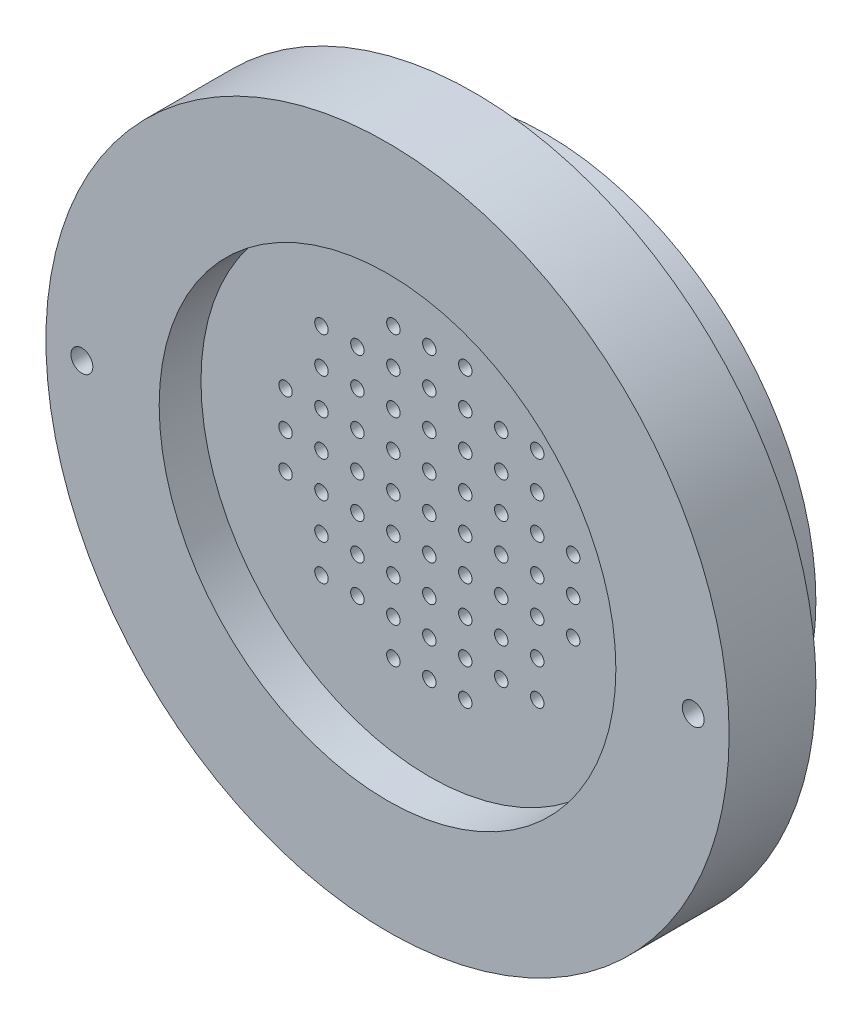
from build123d import *

# Parameters (mm, degrees)
SKETCH1_R                                           = 38
BOSS_EXTRUDE1_DEPTH                                 = 5
SKETCH2_R                                           = 0.75
CUT_EXTRUDE1_DEPTH                                  = 54.972215074
LPATTERN1_COUNT                                     = 5
LPATTERN1_PITCH                                     = 4
LPATTERN1_COUNT_DIR2                                = 5
LPATTERN1_PITCH_DIR2                                = 4
MIRROR1_COPY_1_SKETCH_R                             = 0.75
MIRROR1_COPY_1_DEPTH                                = 54.972215074
MIRROR1_COPY_2_SKETCH_R                             = 0.75
MIRROR1_COPY_2_DEPTH                                = 54.972215074
MIRROR1_COPY_3_SKETCH_R                             = 0.75
MIRROR1_COPY_3_DEPTH                                = 54.972215074
MIRROR1_COPY_4_SKETCH_R                             = 0.75
MIRROR1_COPY_4_DEPTH                                = 54.972215074
MIRROR1_COPY_5_SKETCH_R                             = 0.75
MIRROR1_COPY_5_DEPTH                                = 54.972215074
MIRROR1_COPY_6_SKETCH_R                             = 0.75
MIRROR1_COPY_6_DEPTH                                = 54.972215074
MIRROR1_COPY_7_SKETCH_R                             = 0.75
MIRROR1_COPY_7_DEPTH                                = 54.972215074
MIRROR1_COPY_8_SKETCH_R                             = 0.75
MIRROR1_COPY_8_DEPTH                                = 54.972215074
MIRROR1_COPY_9_SKETCH_R                             = 0.75
MIRROR1_COPY_9_DEPTH                                = 54.972215074
MIRROR1_COPY_10_SKETCH_R                            = 0.75
MIRROR1_COPY_10_DEPTH                               = 54.972215074
MIRROR1_COPY_11_SKETCH_R                            = 0.75
MIRROR1_COPY_11_DEPTH                               = 54.972215074
MIRROR1_COPY_12_SKETCH_R                            = 0.75
MIRROR1_COPY_12_DEPTH                               = 54.972215074
MIRROR1_COPY_13_SKETCH_R                            = 0.75
MIRROR1_COPY_13_DEPTH                               = 54.972215074
MIRROR1_COPY_14_SKETCH_R                            = 0.75
MIRROR1_COPY_14_DEPTH                               = 54.972215074
MIRROR1_COPY_15_SKETCH_R                            = 0.75
MIRROR1_COPY_15_DEPTH                               = 54.972215074
MIRROR1_COPY_16_SKETCH_R                            = 0.75
MIRROR1_COPY_16_DEPTH                               = 54.972215074
MIRROR1_COPY_17_SKETCH_R                            = 0.75
MIRROR1_COPY_17_DEPTH                               = 54.972215074
MIRROR1_COPY_18_SKETCH_R                            = 0.75
MIRROR1_COPY_18_DEPTH                               = 54.972215074
MIRROR1_COPY_19_SKETCH_R                            = 0.75
MIRROR1_COPY_19_DEPTH                               = 54.972215074
MIRROR1_COPY_20_SKETCH_R                            = 0.75
MIRROR1_COPY_20_DEPTH                               = 54.972215074
MIRROR1_AT_THE_SECOND_PLANE_COPY_1_SKETC_R          = 0.75
MIRROR1_AT_THE_SECOND_PLANE_COPY_1_DEPTH            = 54.972215074
MIRROR1_AT_THE_SECOND_PLANE_COPY_2_SKETC_R          = 0.75
MIRROR1_AT_THE_SECOND_PLANE_COPY_2_DEPTH            = 54.972215074
MIRROR1_AT_THE_SECOND_PLANE_COPY_3_SKETC_R          = 0.75
MIRROR1_AT_THE_SECOND_PLANE_COPY_3_DEPTH            = 54.972215074
MIRROR1_AT_THE_SECOND_PLANE_COPY_4_SKETC_R          = 0.75
MIRROR1_AT_THE_SECOND_PLANE_COPY_4_DEPTH            = 54.972215074
MIRROR1_AT_THE_SECOND_PLANE_COPY_5_SKETC_R          = 0.75
MIRROR1_AT_THE_SECOND_PLANE_COPY_5_DEPTH            = 54.972215074
MIRROR1_AT_THE_SECOND_PLANE_COPY_6_SKETC_R          = 0.75
MIRROR1_AT_THE_SECOND_PLANE_COPY_6_DEPTH            = 54.972215074
MIRROR1_AT_THE_SECOND_PLANE_COPY_7_SKETC_R          = 0.75
MIRROR1_AT_THE_SECOND_PLANE_COPY_7_DEPTH            = 54.972215074
MIRROR1_AT_THE_SECOND_PLANE_COPY_8_SKETC_R          = 0.75
MIRROR1_AT_THE_SECOND_PLANE_COPY_8_DEPTH            = 54.972215074
MIRROR1_AT_THE_SECOND_PLANE_COPY_9_SKETC_R          = 0.75
MIRROR1_AT_THE_SECOND_PLANE_COPY_9_DEPTH            = 54.972215074
MIRROR1_AT_THE_SECOND_PLANE_COPY_10_SKET_R          = 0.75
MIRROR1_AT_THE_SECOND_PLANE_COPY_10_DEPTH           = 54.972215074
MIRROR1_AT_THE_SECOND_PLANE_COPY_11_SKET_R          = 0.75
MIRROR1_AT_THE_SECOND_PLANE_COPY_11_DEPTH           = 54.972215074
MIRROR1_AT_THE_SECOND_PLANE_COPY_12_SKET_R          = 0.75
MIRROR1_AT_THE_SECOND_PLANE_COPY_12_DEPTH           = 54.972215074
MIRROR1_AT_THE_SECOND_PLANE_COPY_13_SKET_R          = 0.75
MIRROR1_AT_THE_SECOND_PLANE_COPY_13_DEPTH           = 54.972215074
MIRROR1_AT_THE_SECOND_PLANE_COPY_14_SKET_R          = 0.75
MIRROR1_AT_THE_SECOND_PLANE_COPY_14_DEPTH           = 54.972215074
MIRROR1_AT_THE_SECOND_PLANE_COPY_15_SKET_R          = 0.75
MIRROR1_AT_THE_SECOND_PLANE_COPY_15_DEPTH           = 54.972215074
MIRROR1_AT_THE_SECOND_PLANE_COPY_16_SKET_R          = 0.75
MIRROR1_AT_THE_SECOND_PLANE_COPY_16_DEPTH           = 54.972215074
MIRROR1_AT_THE_SECOND_PLANE_COPY_17_SKET_R          = 0.75
MIRROR1_AT_THE_SECOND_PLANE_COPY_17_DEPTH           = 54.972215074
MIRROR1_AT_THE_SECOND_PLANE_COPY_18_SKET_R          = 0.75
MIRROR1_AT_THE_SECOND_PLANE_COPY_18_DEPTH           = 54.972215074
MIRROR1_AT_THE_SECOND_PLANE_COPY_19_SKET_R          = 0.75
MIRROR1_AT_THE_SECOND_PLANE_COPY_19_DEPTH           = 54.972215074
MIRROR1_AT_THE_SECOND_PLANE_COPY_20_SKET_R          = 0.75
MIRROR1_AT_THE_SECOND_PLANE_COPY_20_DEPTH           = 54.972215074
MIRROR1_AT_THE_SECOND_PLANE_COPY_21_SKET_R          = 0.75
MIRROR1_AT_THE_SECOND_PLANE_COPY_21_DEPTH           = 54.972215074
MIRROR1_AT_THE_SECOND_PLANE_COPY_22_SKET_R          = 0.75
MIRROR1_AT_THE_SECOND_PLANE_COPY_22_DEPTH           = 54.972215074
MIRROR1_AT_THE_SECOND_PLANE_COPY_23_SKET_R          = 0.75
MIRROR1_AT_THE_SECOND_PLANE_COPY_23_DEPTH           = 54.972215074
MIRROR1_AT_THE_SECOND_PLANE_COPY_24_SKET_R          = 0.75
MIRROR1_AT_THE_SECOND_PLANE_COPY_24_DEPTH           = 54.972215074
MIRROR1_AT_THE_SECOND_PLANE_COPY_25_SKET_R          = 0.75
MIRROR1_AT_THE_SECOND_PLANE_COPY_25_DEPTH           = 54.972215074
MIRROR1_AT_THE_SECOND_PLANE_COPY_26_SKET_R          = 0.75
MIRROR1_AT_THE_SECOND_PLANE_COPY_26_DEPTH           = 54.972215074
MIRROR1_AT_THE_SECOND_PLANE_COPY_27_SKET_R          = 0.75
MIRROR1_AT_THE_SECOND_PLANE_COPY_27_DEPTH           = 54.972215074
MIRROR1_AT_THE_SECOND_PLANE_COPY_28_SKET_R          = 0.75
MIRROR1_AT_THE_SECOND_PLANE_COPY_28_DEPTH           = 54.972215074
MIRROR1_AT_THE_SECOND_PLANE_COPY_29_SKET_R          = 0.75
MIRROR1_AT_THE_SECOND_PLANE_COPY_29_DEPTH           = 54.972215074
MIRROR1_AT_THE_SECOND_PLANE_COPY_30_SKET_R          = 0.75
MIRROR1_AT_THE_SECOND_PLANE_COPY_30_DEPTH           = 54.972215074
MIRROR1_AT_THE_SECOND_PLANE_COPY_31_SKET_R          = 0.75
MIRROR1_AT_THE_SECOND_PLANE_COPY_31_DEPTH           = 54.972215074
MIRROR1_AT_THE_SECOND_PLANE_COPY_32_SKET_R          = 0.75
MIRROR1_AT_THE_SECOND_PLANE_COPY_32_DEPTH           = 54.972215074
MIRROR1_AT_THE_SECOND_PLANE_COPY_33_SKET_R          = 0.75
MIRROR1_AT_THE_SECOND_PLANE_COPY_33_DEPTH           = 54.972215074
MIRROR1_AT_THE_SECOND_PLANE_COPY_34_SKET_R          = 0.75
MIRROR1_AT_THE_SECOND_PLANE_COPY_34_DEPTH           = 54.972215074
MIRROR1_AT_THE_SECOND_PLANE_COPY_35_SKET_R          = 0.75
MIRROR1_AT_THE_SECOND_PLANE_COPY_35_DEPTH           = 54.972215074
MIRROR1_AT_THE_SECOND_PLANE_COPY_36_SKET_R          = 0.75
MIRROR1_AT_THE_SECOND_PLANE_COPY_36_DEPTH           = 54.972215074
MIRROR1_AT_THE_SECOND_PLANE_COPY_37_SKET_R          = 0.75
MIRROR1_AT_THE_SECOND_PLANE_COPY_37_DEPTH           = 54.972215074
MIRROR1_AT_THE_SECOND_PLANE_COPY_38_SKET_R          = 0.75
MIRROR1_AT_THE_SECOND_PLANE_COPY_38_DEPTH           = 54.972215074
MIRROR1_AT_THE_SECOND_PLANE_COPY_39_SKET_R          = 0.75
MIRROR1_AT_THE_SECOND_PLANE_COPY_39_DEPTH           = 54.972215074
MIRROR1_AT_THE_SECOND_PLANE_COPY_40_SKET_R          = 0.75
MIRROR1_AT_THE_SECOND_PLANE_COPY_40_DEPTH           = 54.972215074
MIRROR1_AT_THE_SECOND_PLANE_COPY_41_SKET_R          = 0.75
MIRROR1_AT_THE_SECOND_PLANE_COPY_41_DEPTH           = 54.972215074
SKETCH16_R                                          = 38
SKETCH16_R_2                                        = 25.4
BOSS_EXTRUDE2_DEPTH                                 = 4.65
BOSS_EXTRUDE3_START                                 = 8
SKETCH17_R                                          = 30
SKETCH17_R_2                                        = 25.4
BOSS_EXTRUDE3_DEPTH                                 = 8
CBORE_FOR_2_BINDING_HEAD_MACHINE_SCREW1_D           = 2.4384
CBORE_FOR_2_BINDING_HEAD_MACHINE_SCREW1_CBORE_D     = 5.55752
CBORE_FOR_2_BINDING_HEAD_MACHINE_SCREW1_CBORE_DEPTH = 1.27


with BuildPart() as part:
    # Sketch1 → Boss-Extrude1 (new body)
    with BuildSketch(Plane.XY):
        Circle(SKETCH1_R)
    extrude(amount=BOSS_EXTRUDE1_DEPTH)

    # Sketch2 → Cut-Extrude1 (cut, through all)
    with BuildSketch(Plane.XY.offset(5)):
        Circle(SKETCH2_R)
    cut_extrude1 = extrude(amount=-CUT_EXTRUDE1_DEPTH, mode=Mode.SUBTRACT)

    # LPattern1: Cut-Extrude1 5 × 5, 5 skipped
    with Locations(*[(j * LPATTERN1_PITCH_DIR2, i * LPATTERN1_PITCH, 0) for i in range(LPATTERN1_COUNT) for j in range(LPATTERN1_COUNT_DIR2) if (i, j) not in ((0, 0), (2, 4), (3, 4), (4, 2), (4, 3), (4, 4))]):
        add(cut_extrude1, mode=Mode.SUBTRACT)

    # Mirror1 copy 1 sketch → Mirror1 copy 1 (cut, through all)
    with BuildSketch(Plane(origin=(-4, 0, 5), x_dir=(-1, 0, 0), z_dir=(0, 0, 1))):
        Circle(MIRROR1_COPY_1_SKETCH_R)
    extrude(amount=-MIRROR1_COPY_1_DEPTH, mode=Mode.SUBTRACT)

    # Mirror1 copy 2 sketch → Mirror1 copy 2 (cut, through all)
    with BuildSketch(Plane(origin=(-8, 0, 5), x_dir=(-1, 0, 0), z_dir=(0, 0, 1))):
        Circle(MIRROR1_COPY_2_SKETCH_R)
    extrude(amount=-MIRROR1_COPY_2_DEPTH, mode=Mode.SUBTRACT)

    # Mirror1 copy 3 sketch → Mirror1 copy 3 (cut, through all)
    with BuildSketch(Plane(origin=(-12, 0, 5), x_dir=(-1, 0, 0), z_dir=(0, 0, 1))):
        Circle(MIRROR1_COPY_3_SKETCH_R)
    extrude(amount=-MIRROR1_COPY_3_DEPTH, mode=Mode.SUBTRACT)

    # Mirror1 copy 4 sketch → Mirror1 copy 4 (cut, through all)
    with BuildSketch(Plane(origin=(-16, 0, 5), x_dir=(-1, 0, 0), z_dir=(0, 0, 1))):
        Circle(MIRROR1_COPY_4_SKETCH_R)
    extrude(amount=-MIRROR1_COPY_4_DEPTH, mode=Mode.SUBTRACT)

    # Mirror1 copy 5 sketch → Mirror1 copy 5 (cut, through all)
    with BuildSketch(Plane(origin=(0, 4, 5), x_dir=(-1, 0, 0), z_dir=(0, 0, 1))):
        Circle(MIRROR1_COPY_5_SKETCH_R)
    extrude(amount=-MIRROR1_COPY_5_DEPTH, mode=Mode.SUBTRACT)

    # Mirror1 copy 6 sketch → Mirror1 copy 6 (cut, through all)
    with BuildSketch(Plane(origin=(-4, 4, 5), x_dir=(-1, 0, 0), z_dir=(0, 0, 1))):
        Circle(MIRROR1_COPY_6_SKETCH_R)
    extrude(amount=-MIRROR1_COPY_6_DEPTH, mode=Mode.SUBTRACT)

    # Mirror1 copy 7 sketch → Mirror1 copy 7 (cut, through all)
    with BuildSketch(Plane(origin=(-8, 4, 5), x_dir=(-1, 0, 0), z_dir=(0, 0, 1))):
        Circle(MIRROR1_COPY_7_SKETCH_R)
    extrude(amount=-MIRROR1_COPY_7_DEPTH, mode=Mode.SUBTRACT)

    # Mirror1 copy 8 sketch → Mirror1 copy 8 (cut, through all)
    with BuildSketch(Plane(origin=(-12, 4, 5), x_dir=(-1, 0, 0), z_dir=(0, 0, 1))):
        Circle(MIRROR1_COPY_8_SKETCH_R)
    extrude(amount=-MIRROR1_COPY_8_DEPTH, mode=Mode.SUBTRACT)

    # Mirror1 copy 9 sketch → Mirror1 copy 9 (cut, through all)
    with BuildSketch(Plane(origin=(-16, 4, 5), x_dir=(-1, 0, 0), z_dir=(0, 0, 1))):
        Circle(MIRROR1_COPY_9_SKETCH_R)
    extrude(amount=-MIRROR1_COPY_9_DEPTH, mode=Mode.SUBTRACT)

    # Mirror1 copy 10 sketch → Mirror1 copy 10 (cut, through all)
    with BuildSketch(Plane(origin=(0, 8, 5), x_dir=(-1, 0, 0), z_dir=(0, 0, 1))):
        Circle(MIRROR1_COPY_10_SKETCH_R)
    extrude(amount=-MIRROR1_COPY_10_DEPTH, mode=Mode.SUBTRACT)

    # Mirror1 copy 11 sketch → Mirror1 copy 11 (cut, through all)
    with BuildSketch(Plane(origin=(-4, 8, 5), x_dir=(-1, 0, 0), z_dir=(0, 0, 1))):
        Circle(MIRROR1_COPY_11_SKETCH_R)
    extrude(amount=-MIRROR1_COPY_11_DEPTH, mode=Mode.SUBTRACT)

    # Mirror1 copy 12 sketch → Mirror1 copy 12 (cut, through all)
    with BuildSketch(Plane(origin=(-8, 8, 5), x_dir=(-1, 0, 0), z_dir=(0, 0, 1))):
        Circle(MIRROR1_COPY_12_SKETCH_R)
    extrude(amount=-MIRROR1_COPY_12_DEPTH, mode=Mode.SUBTRACT)

    # Mirror1 copy 13 sketch → Mirror1 copy 13 (cut, through all)
    with BuildSketch(Plane(origin=(-12, 8, 5), x_dir=(-1, 0, 0), z_dir=(0, 0, 1))):
        Circle(MIRROR1_COPY_13_SKETCH_R)
    extrude(amount=-MIRROR1_COPY_13_DEPTH, mode=Mode.SUBTRACT)

    # Mirror1 copy 14 sketch → Mirror1 copy 14 (cut, through all)
    with BuildSketch(Plane(origin=(0, 12, 5), x_dir=(-1, 0, 0), z_dir=(0, 0, 1))):
        Circle(MIRROR1_COPY_14_SKETCH_R)
    extrude(amount=-MIRROR1_COPY_14_DEPTH, mode=Mode.SUBTRACT)

    # Mirror1 copy 15 sketch → Mirror1 copy 15 (cut, through all)
    with BuildSketch(Plane(origin=(-4, 12, 5), x_dir=(-1, 0, 0), z_dir=(0, 0, 1))):
        Circle(MIRROR1_COPY_15_SKETCH_R)
    extrude(amount=-MIRROR1_COPY_15_DEPTH, mode=Mode.SUBTRACT)

    # Mirror1 copy 16 sketch → Mirror1 copy 16 (cut, through all)
    with BuildSketch(Plane(origin=(-8, 12, 5), x_dir=(-1, 0, 0), z_dir=(0, 0, 1))):
        Circle(MIRROR1_COPY_16_SKETCH_R)
    extrude(amount=-MIRROR1_COPY_16_DEPTH, mode=Mode.SUBTRACT)

    # Mirror1 copy 17 sketch → Mirror1 copy 17 (cut, through all)
    with BuildSketch(Plane(origin=(-12, 12, 5), x_dir=(-1, 0, 0), z_dir=(0, 0, 1))):
        Circle(MIRROR1_COPY_17_SKETCH_R)
    extrude(amount=-MIRROR1_COPY_17_DEPTH, mode=Mode.SUBTRACT)

    # Mirror1 copy 18 sketch → Mirror1 copy 18 (cut, through all)
    with BuildSketch(Plane(origin=(0, 16, 5), x_dir=(-1, 0, 0), z_dir=(0, 0, 1))):
        Circle(MIRROR1_COPY_18_SKETCH_R)
    extrude(amount=-MIRROR1_COPY_18_DEPTH, mode=Mode.SUBTRACT)

    # Mirror1 copy 19 sketch → Mirror1 copy 19 (cut, through all)
    with BuildSketch(Plane(origin=(-4, 16, 5), x_dir=(-1, 0, 0), z_dir=(0, 0, 1))):
        Circle(MIRROR1_COPY_19_SKETCH_R)
    extrude(amount=-MIRROR1_COPY_19_DEPTH, mode=Mode.SUBTRACT)

    # Mirror1 copy 20 sketch → Mirror1 copy 20 (cut, through all)
    with BuildSketch(Plane(origin=(0, 0, 5), x_dir=(-1, 0, 0), z_dir=(0, 0, 1))):
        Circle(MIRROR1_COPY_20_SKETCH_R)
    extrude(amount=-MIRROR1_COPY_20_DEPTH, mode=Mode.SUBTRACT)

    # Mirror1 at the second plane copy 1 sketc → Mirror1 at the second plane copy 1 (cut, through all)
    with BuildSketch(Plane(origin=(4, 0, 5), x_dir=(1, 0, 0), z_dir=(0, 0, 1))):
        Circle(MIRROR1_AT_THE_SECOND_PLANE_COPY_1_SKETC_R)
    extrude(amount=-MIRROR1_AT_THE_SECOND_PLANE_COPY_1_DEPTH, mode=Mode.SUBTRACT)

    # Mirror1 at the second plane copy 2 sketc → Mirror1 at the second plane copy 2 (cut, through all)
    with BuildSketch(Plane(origin=(8, 0, 5), x_dir=(1, 0, 0), z_dir=(0, 0, 1))):
        Circle(MIRROR1_AT_THE_SECOND_PLANE_COPY_2_SKETC_R)
    extrude(amount=-MIRROR1_AT_THE_SECOND_PLANE_COPY_2_DEPTH, mode=Mode.SUBTRACT)

    # Mirror1 at the second plane copy 3 sketc → Mirror1 at the second plane copy 3 (cut, through all)
    with BuildSketch(Plane(origin=(12, 0, 5), x_dir=(1, 0, 0), z_dir=(0, 0, 1))):
        Circle(MIRROR1_AT_THE_SECOND_PLANE_COPY_3_SKETC_R)
    extrude(amount=-MIRROR1_AT_THE_SECOND_PLANE_COPY_3_DEPTH, mode=Mode.SUBTRACT)

    # Mirror1 at the second plane copy 4 sketc → Mirror1 at the second plane copy 4 (cut, through all)
    with BuildSketch(Plane(origin=(16, 0, 5), x_dir=(1, 0, 0), z_dir=(0, 0, 1))):
        Circle(MIRROR1_AT_THE_SECOND_PLANE_COPY_4_SKETC_R)
    extrude(amount=-MIRROR1_AT_THE_SECOND_PLANE_COPY_4_DEPTH, mode=Mode.SUBTRACT)

    # Mirror1 at the second plane copy 5 sketc → Mirror1 at the second plane copy 5 (cut, through all)
    with BuildSketch(Plane(origin=(0, -4, 5), x_dir=(1, 0, 0), z_dir=(0, 0, 1))):
        Circle(MIRROR1_AT_THE_SECOND_PLANE_COPY_5_SKETC_R)
    extrude(amount=-MIRROR1_AT_THE_SECOND_PLANE_COPY_5_DEPTH, mode=Mode.SUBTRACT)

    # Mirror1 at the second plane copy 6 sketc → Mirror1 at the second plane copy 6 (cut, through all)
    with BuildSketch(Plane(origin=(4, -4, 5), x_dir=(1, 0, 0), z_dir=(0, 0, 1))):
        Circle(MIRROR1_AT_THE_SECOND_PLANE_COPY_6_SKETC_R)
    extrude(amount=-MIRROR1_AT_THE_SECOND_PLANE_COPY_6_DEPTH, mode=Mode.SUBTRACT)

    # Mirror1 at the second plane copy 7 sketc → Mirror1 at the second plane copy 7 (cut, through all)
    with BuildSketch(Plane(origin=(8, -4, 5), x_dir=(1, 0, 0), z_dir=(0, 0, 1))):
        Circle(MIRROR1_AT_THE_SECOND_PLANE_COPY_7_SKETC_R)
    extrude(amount=-MIRROR1_AT_THE_SECOND_PLANE_COPY_7_DEPTH, mode=Mode.SUBTRACT)

    # Mirror1 at the second plane copy 8 sketc → Mirror1 at the second plane copy 8 (cut, through all)
    with BuildSketch(Plane(origin=(12, -4, 5), x_dir=(1, 0, 0), z_dir=(0, 0, 1))):
        Circle(MIRROR1_AT_THE_SECOND_PLANE_COPY_8_SKETC_R)
    extrude(amount=-MIRROR1_AT_THE_SECOND_PLANE_COPY_8_DEPTH, mode=Mode.SUBTRACT)

    # Mirror1 at the second plane copy 9 sketc → Mirror1 at the second plane copy 9 (cut, through all)
    with BuildSketch(Plane(origin=(16, -4, 5), x_dir=(1, 0, 0), z_dir=(0, 0, 1))):
        Circle(MIRROR1_AT_THE_SECOND_PLANE_COPY_9_SKETC_R)
    extrude(amount=-MIRROR1_AT_THE_SECOND_PLANE_COPY_9_DEPTH, mode=Mode.SUBTRACT)

    # Mirror1 at the second plane copy 10 sket → Mirror1 at the second plane copy 10 (cut, through all)
    with BuildSketch(Plane(origin=(0, -8, 5), x_dir=(1, 0, 0), z_dir=(0, 0, 1))):
        Circle(MIRROR1_AT_THE_SECOND_PLANE_COPY_10_SKET_R)
    extrude(amount=-MIRROR1_AT_THE_SECOND_PLANE_COPY_10_DEPTH, mode=Mode.SUBTRACT)

    # Mirror1 at the second plane copy 11 sket → Mirror1 at the second plane copy 11 (cut, through all)
    with BuildSketch(Plane(origin=(4, -8, 5), x_dir=(1, 0, 0), z_dir=(0, 0, 1))):
        Circle(MIRROR1_AT_THE_SECOND_PLANE_COPY_11_SKET_R)
    extrude(amount=-MIRROR1_AT_THE_SECOND_PLANE_COPY_11_DEPTH, mode=Mode.SUBTRACT)

    # Mirror1 at the second plane copy 12 sket → Mirror1 at the second plane copy 12 (cut, through all)
    with BuildSketch(Plane(origin=(8, -8, 5), x_dir=(1, 0, 0), z_dir=(0, 0, 1))):
        Circle(MIRROR1_AT_THE_SECOND_PLANE_COPY_12_SKET_R)
    extrude(amount=-MIRROR1_AT_THE_SECOND_PLANE_COPY_12_DEPTH, mode=Mode.SUBTRACT)

    # Mirror1 at the second plane copy 13 sket → Mirror1 at the second plane copy 13 (cut, through all)
    with BuildSketch(Plane(origin=(12, -8, 5), x_dir=(1, 0, 0), z_dir=(0, 0, 1))):
        Circle(MIRROR1_AT_THE_SECOND_PLANE_COPY_13_SKET_R)
    extrude(amount=-MIRROR1_AT_THE_SECOND_PLANE_COPY_13_DEPTH, mode=Mode.SUBTRACT)

    # Mirror1 at the second plane copy 14 sket → Mirror1 at the second plane copy 14 (cut, through all)
    with BuildSketch(Plane(origin=(0, -12, 5), x_dir=(1, 0, 0), z_dir=(0, 0, 1))):
        Circle(MIRROR1_AT_THE_SECOND_PLANE_COPY_14_SKET_R)
    extrude(amount=-MIRROR1_AT_THE_SECOND_PLANE_COPY_14_DEPTH, mode=Mode.SUBTRACT)

    # Mirror1 at the second plane copy 15 sket → Mirror1 at the second plane copy 15 (cut, through all)
    with BuildSketch(Plane(origin=(4, -12, 5), x_dir=(1, 0, 0), z_dir=(0, 0, 1))):
        Circle(MIRROR1_AT_THE_SECOND_PLANE_COPY_15_SKET_R)
    extrude(amount=-MIRROR1_AT_THE_SECOND_PLANE_COPY_15_DEPTH, mode=Mode.SUBTRACT)

    # Mirror1 at the second plane copy 16 sket → Mirror1 at the second plane copy 16 (cut, through all)
    with BuildSketch(Plane(origin=(8, -12, 5), x_dir=(1, 0, 0), z_dir=(0, 0, 1))):
        Circle(MIRROR1_AT_THE_SECOND_PLANE_COPY_16_SKET_R)
    extrude(amount=-MIRROR1_AT_THE_SECOND_PLANE_COPY_16_DEPTH, mode=Mode.SUBTRACT)

    # Mirror1 at the second plane copy 17 sket → Mirror1 at the second plane copy 17 (cut, through all)
    with BuildSketch(Plane(origin=(12, -12, 5), x_dir=(1, 0, 0), z_dir=(0, 0, 1))):
        Circle(MIRROR1_AT_THE_SECOND_PLANE_COPY_17_SKET_R)
    extrude(amount=-MIRROR1_AT_THE_SECOND_PLANE_COPY_17_DEPTH, mode=Mode.SUBTRACT)

    # Mirror1 at the second plane copy 18 sket → Mirror1 at the second plane copy 18 (cut, through all)
    with BuildSketch(Plane(origin=(0, -16, 5), x_dir=(1, 0, 0), z_dir=(0, 0, 1))):
        Circle(MIRROR1_AT_THE_SECOND_PLANE_COPY_18_SKET_R)
    extrude(amount=-MIRROR1_AT_THE_SECOND_PLANE_COPY_18_DEPTH, mode=Mode.SUBTRACT)

    # Mirror1 at the second plane copy 19 sket → Mirror1 at the second plane copy 19 (cut, through all)
    with BuildSketch(Plane(origin=(4, -16, 5), x_dir=(1, 0, 0), z_dir=(0, 0, 1))):
        Circle(MIRROR1_AT_THE_SECOND_PLANE_COPY_19_SKET_R)
    extrude(amount=-MIRROR1_AT_THE_SECOND_PLANE_COPY_19_DEPTH, mode=Mode.SUBTRACT)

    # Mirror1 at the second plane copy 20 sket → Mirror1 at the second plane copy 20 (cut, through all)
    with BuildSketch(Plane.XY.offset(5)):
        Circle(MIRROR1_AT_THE_SECOND_PLANE_COPY_20_SKET_R)
    extrude(amount=-MIRROR1_AT_THE_SECOND_PLANE_COPY_20_DEPTH, mode=Mode.SUBTRACT)

    # Mirror1 at the second plane copy 21 sket → Mirror1 at the second plane copy 21 (cut, through all)
    with BuildSketch(Plane(origin=(-4, 0, 5), x_dir=(-1, 0, 0), z_dir=(0, 0, 1))):
        Circle(MIRROR1_AT_THE_SECOND_PLANE_COPY_21_SKET_R)
    extrude(amount=-MIRROR1_AT_THE_SECOND_PLANE_COPY_21_DEPTH, mode=Mode.SUBTRACT)

    # Mirror1 at the second plane copy 22 sket → Mirror1 at the second plane copy 22 (cut, through all)
    with BuildSketch(Plane(origin=(-8, 0, 5), x_dir=(-1, 0, 0), z_dir=(0, 0, 1))):
        Circle(MIRROR1_AT_THE_SECOND_PLANE_COPY_22_SKET_R)
    extrude(amount=-MIRROR1_AT_THE_SECOND_PLANE_COPY_22_DEPTH, mode=Mode.SUBTRACT)

    # Mirror1 at the second plane copy 23 sket → Mirror1 at the second plane copy 23 (cut, through all)
    with BuildSketch(Plane(origin=(-12, 0, 5), x_dir=(-1, 0, 0), z_dir=(0, 0, 1))):
        Circle(MIRROR1_AT_THE_SECOND_PLANE_COPY_23_SKET_R)
    extrude(amount=-MIRROR1_AT_THE_SECOND_PLANE_COPY_23_DEPTH, mode=Mode.SUBTRACT)

    # Mirror1 at the second plane copy 24 sket → Mirror1 at the second plane copy 24 (cut, through all)
    with BuildSketch(Plane(origin=(-16, 0, 5), x_dir=(-1, 0, 0), z_dir=(0, 0, 1))):
        Circle(MIRROR1_AT_THE_SECOND_PLANE_COPY_24_SKET_R)
    extrude(amount=-MIRROR1_AT_THE_SECOND_PLANE_COPY_24_DEPTH, mode=Mode.SUBTRACT)

    # Mirror1 at the second plane copy 25 sket → Mirror1 at the second plane copy 25 (cut, through all)
    with BuildSketch(Plane(origin=(0, -4, 5), x_dir=(-1, 0, 0), z_dir=(0, 0, 1))):
        Circle(MIRROR1_AT_THE_SECOND_PLANE_COPY_25_SKET_R)
    extrude(amount=-MIRROR1_AT_THE_SECOND_PLANE_COPY_25_DEPTH, mode=Mode.SUBTRACT)

    # Mirror1 at the second plane copy 26 sket → Mirror1 at the second plane copy 26 (cut, through all)
    with BuildSketch(Plane(origin=(-4, -4, 5), x_dir=(-1, 0, 0), z_dir=(0, 0, 1))):
        Circle(MIRROR1_AT_THE_SECOND_PLANE_COPY_26_SKET_R)
    extrude(amount=-MIRROR1_AT_THE_SECOND_PLANE_COPY_26_DEPTH, mode=Mode.SUBTRACT)

    # Mirror1 at the second plane copy 27 sket → Mirror1 at the second plane copy 27 (cut, through all)
    with BuildSketch(Plane(origin=(-8, -4, 5), x_dir=(-1, 0, 0), z_dir=(0, 0, 1))):
        Circle(MIRROR1_AT_THE_SECOND_PLANE_COPY_27_SKET_R)
    extrude(amount=-MIRROR1_AT_THE_SECOND_PLANE_COPY_27_DEPTH, mode=Mode.SUBTRACT)

    # Mirror1 at the second plane copy 28 sket → Mirror1 at the second plane copy 28 (cut, through all)
    with BuildSketch(Plane(origin=(-12, -4, 5), x_dir=(-1, 0, 0), z_dir=(0, 0, 1))):
        Circle(MIRROR1_AT_THE_SECOND_PLANE_COPY_28_SKET_R)
    extrude(amount=-MIRROR1_AT_THE_SECOND_PLANE_COPY_28_DEPTH, mode=Mode.SUBTRACT)

    # Mirror1 at the second plane copy 29 sket → Mirror1 at the second plane copy 29 (cut, through all)
    with BuildSketch(Plane(origin=(-16, -4, 5), x_dir=(-1, 0, 0), z_dir=(0, 0, 1))):
        Circle(MIRROR1_AT_THE_SECOND_PLANE_COPY_29_SKET_R)
    extrude(amount=-MIRROR1_AT_THE_SECOND_PLANE_COPY_29_DEPTH, mode=Mode.SUBTRACT)

    # Mirror1 at the second plane copy 30 sket → Mirror1 at the second plane copy 30 (cut, through all)
    with BuildSketch(Plane(origin=(0, -8, 5), x_dir=(-1, 0, 0), z_dir=(0, 0, 1))):
        Circle(MIRROR1_AT_THE_SECOND_PLANE_COPY_30_SKET_R)
    extrude(amount=-MIRROR1_AT_THE_SECOND_PLANE_COPY_30_DEPTH, mode=Mode.SUBTRACT)

    # Mirror1 at the second plane copy 31 sket → Mirror1 at the second plane copy 31 (cut, through all)
    with BuildSketch(Plane(origin=(-4, -8, 5), x_dir=(-1, 0, 0), z_dir=(0, 0, 1))):
        Circle(MIRROR1_AT_THE_SECOND_PLANE_COPY_31_SKET_R)
    extrude(amount=-MIRROR1_AT_THE_SECOND_PLANE_COPY_31_DEPTH, mode=Mode.SUBTRACT)

    # Mirror1 at the second plane copy 32 sket → Mirror1 at the second plane copy 32 (cut, through all)
    with BuildSketch(Plane(origin=(-8, -8, 5), x_dir=(-1, 0, 0), z_dir=(0, 0, 1))):
        Circle(MIRROR1_AT_THE_SECOND_PLANE_COPY_32_SKET_R)
    extrude(amount=-MIRROR1_AT_THE_SECOND_PLANE_COPY_32_DEPTH, mode=Mode.SUBTRACT)

    # Mirror1 at the second plane copy 33 sket → Mirror1 at the second plane copy 33 (cut, through all)
    with BuildSketch(Plane(origin=(-12, -8, 5), x_dir=(-1, 0, 0), z_dir=(0, 0, 1))):
        Circle(MIRROR1_AT_THE_SECOND_PLANE_COPY_33_SKET_R)
    extrude(amount=-MIRROR1_AT_THE_SECOND_PLANE_COPY_33_DEPTH, mode=Mode.SUBTRACT)

    # Mirror1 at the second plane copy 34 sket → Mirror1 at the second plane copy 34 (cut, through all)
    with BuildSketch(Plane(origin=(0, -12, 5), x_dir=(-1, 0, 0), z_dir=(0, 0, 1))):
        Circle(MIRROR1_AT_THE_SECOND_PLANE_COPY_34_SKET_R)
    extrude(amount=-MIRROR1_AT_THE_SECOND_PLANE_COPY_34_DEPTH, mode=Mode.SUBTRACT)

    # Mirror1 at the second plane copy 35 sket → Mirror1 at the second plane copy 35 (cut, through all)
    with BuildSketch(Plane(origin=(-4, -12, 5), x_dir=(-1, 0, 0), z_dir=(0, 0, 1))):
        Circle(MIRROR1_AT_THE_SECOND_PLANE_COPY_35_SKET_R)
    extrude(amount=-MIRROR1_AT_THE_SECOND_PLANE_COPY_35_DEPTH, mode=Mode.SUBTRACT)

    # Mirror1 at the second plane copy 36 sket → Mirror1 at the second plane copy 36 (cut, through all)
    with BuildSketch(Plane(origin=(-8, -12, 5), x_dir=(-1, 0, 0), z_dir=(0, 0, 1))):
        Circle(MIRROR1_AT_THE_SECOND_PLANE_COPY_36_SKET_R)
    extrude(amount=-MIRROR1_AT_THE_SECOND_PLANE_COPY_36_DEPTH, mode=Mode.SUBTRACT)

    # Mirror1 at the second plane copy 37 sket → Mirror1 at the second plane copy 37 (cut, through all)
    with BuildSketch(Plane(origin=(-12, -12, 5), x_dir=(-1, 0, 0), z_dir=(0, 0, 1))):
        Circle(MIRROR1_AT_THE_SECOND_PLANE_COPY_37_SKET_R)
    extrude(amount=-MIRROR1_AT_THE_SECOND_PLANE_COPY_37_DEPTH, mode=Mode.SUBTRACT)

    # Mirror1 at the second plane copy 38 sket → Mirror1 at the second plane copy 38 (cut, through all)
    with BuildSketch(Plane(origin=(0, -16, 5), x_dir=(-1, 0, 0), z_dir=(0, 0, 1))):
        Circle(MIRROR1_AT_THE_SECOND_PLANE_COPY_38_SKET_R)
    extrude(amount=-MIRROR1_AT_THE_SECOND_PLANE_COPY_38_DEPTH, mode=Mode.SUBTRACT)

    # Mirror1 at the second plane copy 39 sket → Mirror1 at the second plane copy 39 (cut, through all)
    with BuildSketch(Plane(origin=(-4, -16, 5), x_dir=(-1, 0, 0), z_dir=(0, 0, 1))):
        Circle(MIRROR1_AT_THE_SECOND_PLANE_COPY_39_SKET_R)
    extrude(amount=-MIRROR1_AT_THE_SECOND_PLANE_COPY_39_DEPTH, mode=Mode.SUBTRACT)

    # Mirror1 at the second plane copy 40 sket → Mirror1 at the second plane copy 40 (cut, through all)
    with BuildSketch(Plane(origin=(0, 0, 5), x_dir=(-1, 0, 0), z_dir=(0, 0, 1))):
        Circle(MIRROR1_AT_THE_SECOND_PLANE_COPY_40_SKET_R)
    extrude(amount=-MIRROR1_AT_THE_SECOND_PLANE_COPY_40_DEPTH, mode=Mode.SUBTRACT)

    # Mirror1 at the second plane copy 41 sket → Mirror1 at the second plane copy 41 (cut, through all)
    with BuildSketch(Plane.XY.offset(5)):
        Circle(MIRROR1_AT_THE_SECOND_PLANE_COPY_41_SKET_R)
    extrude(amount=-MIRROR1_AT_THE_SECOND_PLANE_COPY_41_DEPTH, mode=Mode.SUBTRACT)

    # Sketch16 → Boss-Extrude2 (add)
    with BuildSketch(Plane.XY.offset(5)):
        Circle(SKETCH16_R)
        Circle(SKETCH16_R_2, mode=Mode.SUBTRACT)
    extrude(amount=BOSS_EXTRUDE2_DEPTH)

    # Sketch17 → Boss-Extrude3 (add)
    with BuildSketch(Plane(origin=(0, 0, 0), x_dir=(-1, 0, 0), z_dir=(0, 0, -1)).offset(BOSS_EXTRUDE3_START)):
        Circle(SKETCH17_R)
        Circle(SKETCH17_R_2, mode=Mode.SUBTRACT)
    extrude(amount=-BOSS_EXTRUDE3_DEPTH)

    # CBORE for #2 Binding Head Machine Screw1 (through all)
    with Locations(Plane(origin=(0, 0, 0), x_dir=(-1, 0, 0), z_dir=(0, 0, -1))):
        with Locations((-34, 0)):
            cbore_for_2_binding_head_machine_screw1 = CounterBoreHole(CBORE_FOR_2_BINDING_HEAD_MACHINE_SCREW1_D / 2, CBORE_FOR_2_BINDING_HEAD_MACHINE_SCREW1_CBORE_D / 2, CBORE_FOR_2_BINDING_HEAD_MACHINE_SCREW1_CBORE_DEPTH)

    # Mirror2: CBORE for #2 Binding Head Machine Screw1 across plane
    add(cbore_for_2_binding_head_machine_screw1.mirror(Plane(origin=(0, 0, 0), x_dir=(0, 0, 1), z_dir=(1, 0, 0))), mode=Mode.SUBTRACT)


solid = part.part
